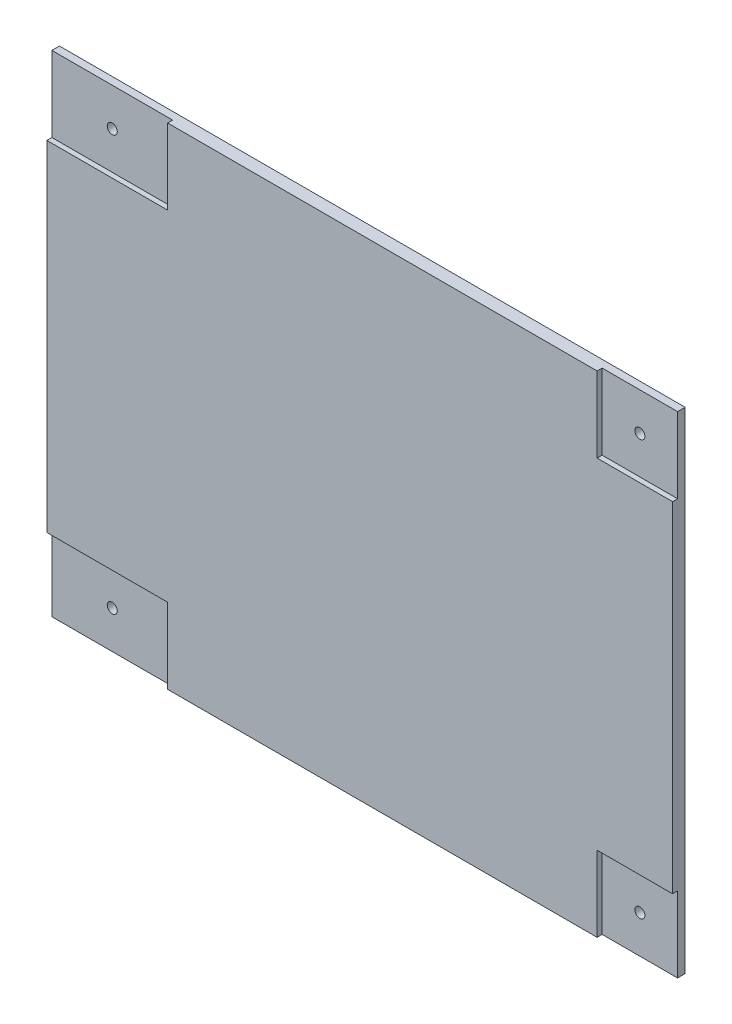
from build123d import *

# Parameters (mm, degrees)
CROQUIS1_W              = 248.76
CROQUIS1_H              = 195
SALIENTE_EXTRUIR1_DEPTH = 5
CROQUIS2_W              = 48
CROQUIS2_H              = 30
CROQUIS2_W_2            = 30
CORTAR_EXTRUIR1_DEPTH   = 2
CROQUIS3_R              = 2
CORTAR_EXTRUIR2_DEPTH   = 10


with BuildPart() as part:
    # Croquis1 → Saliente-Extruir1 (new body)
    with BuildSketch(Plane.XY):
        with Locations((7.088293187, 0.26268)):
            Rectangle(CROQUIS1_W, CROQUIS1_H)
    extrude(amount=SALIENTE_EXTRUIR1_DEPTH)

    # Croquis2 → Cortar-Extruir1 (cut)
    with BuildSketch(Plane.XY.offset(5)):
        with Locations((-93.291706813, -82.23732)):
            Rectangle(CROQUIS2_W, CROQUIS2_H)
        with Locations((116.468293187, 82.76268)):
            Rectangle(CROQUIS2_W_2, CROQUIS2_H)
        with Locations((116.468293187, -82.23732)):
            Rectangle(CROQUIS2_W_2, CROQUIS2_H)
        with Locations((-93.291706813, 82.76268)):
            Rectangle(CROQUIS2_W, CROQUIS2_H)
    extrude(amount=-CORTAR_EXTRUIR1_DEPTH, mode=Mode.SUBTRACT)

    # Croquis3 → Cortar-Extruir2 (cut)
    with BuildSketch(Plane.XY.offset(5)):
        with Locations((-93.291706813, 82.76268)):
            Circle(CROQUIS3_R)
        with Locations((-93.291706813, -82.23732)):
            Circle(CROQUIS3_R)
        with Locations((116.468293187, 82.76268)):
            Circle(CROQUIS3_R)
        with Locations((116.468293187, -82.23732)):
            Circle(CROQUIS3_R)
    extrude(amount=-CORTAR_EXTRUIR2_DEPTH, mode=Mode.SUBTRACT)


solid = part.part
